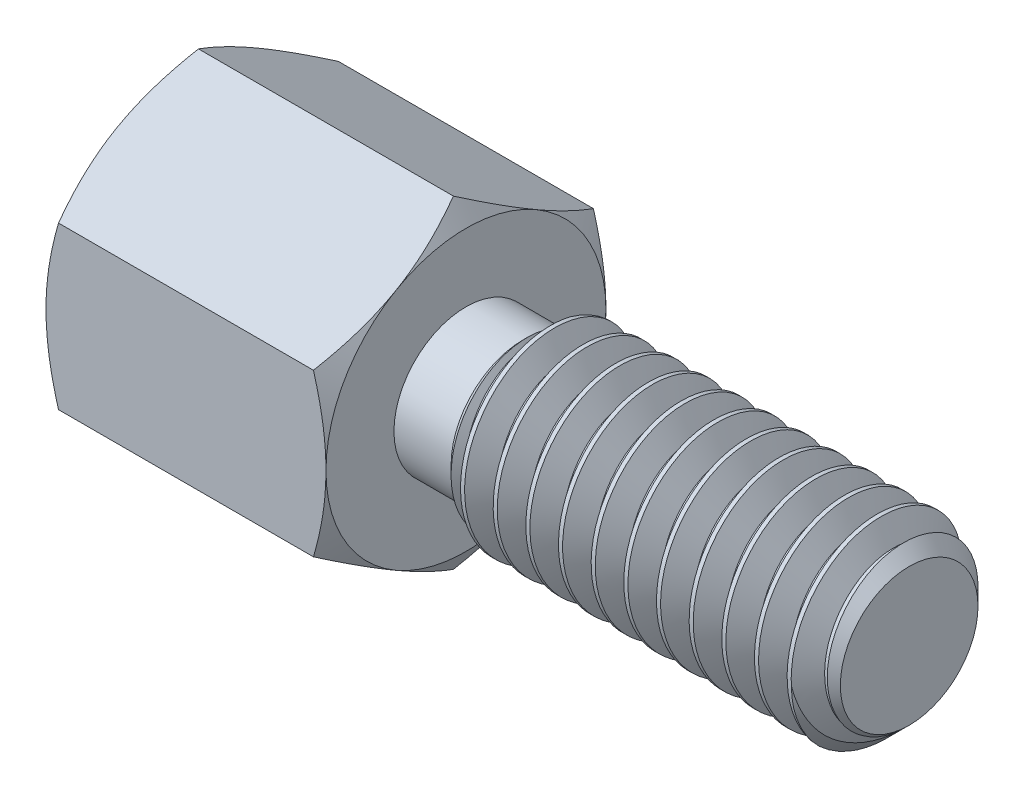
from build123d import *

# Parameters (mm, degrees)
SKETCH2_R         = 2
EXTRUDE1_DEPTH    = 9.5
CHAMFER1_SIZE     = 0.525
CUT_SWEEP1_PITCH  = 0.7
EXTRUDE4_DEPTH    = 6
SKETCH8_OUTSIDE_W = 71.056
SKETCH8_OUTSIDE_H = 71.984
SKETCH8_OUTSIDE_R = 3
EXTRUDE5_DEPTH    = 17.163229971
EXTRUDE5_DRAFT    = -60
SKETCH9_OUTSIDE_W = 51.604
SKETCH9_OUTSIDE_H = 52.532
SKETCH9_OUTSIDE_R = 3
EXTRUDE6_DEPTH    = 11.547511645
EXTRUDE6_DRAFT    = -60
EXTRUDE7_START    = -2.1
SKETCH10_R        = 2
EXTRUDE7_DEPTH    = 2.1
SWEEP3_PITCH      = 0.7
SKETCH13_R        = 2.0508
EXTRUDE8_DEPTH    = 17.16322999


with BuildPart() as part:
    # Sketch2 → Extrude1 (new body)
    with BuildSketch(Plane(origin=(7.75, 0, 0), x_dir=(0, 0, -1), z_dir=(1, 0, 0))):
        Circle(SKETCH2_R)
    extrude(amount=-EXTRUDE1_DEPTH)

    # Chamfer1
    chamfer1_edges = [part.edges().sort_by_distance(p)[0] for p in [
        (7.75, 0, 2),
    ]]
    chamfer(chamfer1_edges, length=CHAMFER1_SIZE)

    # Cut-Sweep1: the profile of Sketch4 profile screwed along a right-hand helix of 14.571429 turns, 6 arcs to a turn; built about Z, then put on its axis
    cut_sweep1_z = Axis((0, 0, 0), (0, 0, 1))
    cut_sweep1_corners = [(2.0003, 0, 0.000173205), (2.0003, 0, -0.612673205), (1.545336663, 0, -0.35), (1.545336663, 0, -0.2625)]
    with BuildLine(mode=Mode.PRIVATE) as cut_sweep1_profile:
        Line(cut_sweep1_corners[0], cut_sweep1_corners[1])
        Line(cut_sweep1_corners[1], cut_sweep1_corners[2])
        Line(cut_sweep1_corners[2], cut_sweep1_corners[3])
        Line(cut_sweep1_corners[3], cut_sweep1_corners[0])
    cut_sweep1_cap = Face(cut_sweep1_profile.wire())
    cut_sweep1_turn_angles = [0, 30, 60, 90, 120, 150, 180, 210, 240, 270, 300, 330, 360]
    cut_sweep1_turn_weights = [1, 0.8660254037844387, 1, 0.8660254037844387, 1, 0.8660254037844387, 1, 0.8660254037844387, 1, 0.8660254037844387, 1, 0.8660254037844387, 1]
    cut_sweep1_turn_rails = [Edge.make_bspline([Vector(p[0], p[1], 0).rotate(cut_sweep1_z, cut_sweep1_turn_angles[k]) / cut_sweep1_turn_weights[k] + Vector(0, 0, p[2] + CUT_SWEEP1_PITCH * cut_sweep1_turn_angles[k] / 360) for k in range(13)], [0, 0, 0, 1, 1, 2, 2, 3, 3, 4, 4, 5, 5, 6, 6, 6], 2, cut_sweep1_turn_weights) for p in cut_sweep1_corners]
    cut_sweep1_turn_sides = [Face.make_surface_from_curves(cut_sweep1_turn_rails[p[0]], cut_sweep1_turn_rails[p[1]]) for p in [(0, 1), (1, 2), (2, 3), (3, 0)]]
    cut_sweep1_last_angles = [5040, 5070, 5100, 5130, 5160, 5190, 5220, 5232.857142857, 5245.714285714]
    cut_sweep1_last_weights = [1, 0.8660254037844387, 1, 0.8660254037844387, 1, 0.8660254037844387, 1, 0.9749279121818085, 1]
    cut_sweep1_last_rails = [Edge.make_bspline([Vector(p[0], p[1], 0).rotate(cut_sweep1_z, cut_sweep1_last_angles[k]) / cut_sweep1_last_weights[k] + Vector(0, 0, p[2] + CUT_SWEEP1_PITCH * cut_sweep1_last_angles[k] / 360) for k in range(9)], [0, 0, 0, 1, 1, 2, 2, 3, 3, 4, 4, 4], 2, cut_sweep1_last_weights) for p in cut_sweep1_corners]
    cut_sweep1_last_sides = [Face.make_surface_from_curves(cut_sweep1_last_rails[p[0]], cut_sweep1_last_rails[p[1]]) for p in [(0, 1), (1, 2), (2, 3), (3, 0)]]
    cut_sweep1 = Plane(origin=(7.75, 0, 0), x_dir=(0, 1, 0), z_dir=(-1, 0, 0)) * Solid(Shell([*[p.moved(Location((0, 0, CUT_SWEEP1_PITCH * i))) for i in range(14) for p in cut_sweep1_turn_sides], *cut_sweep1_last_sides, cut_sweep1_cap, cut_sweep1_cap.rotate(cut_sweep1_z, 5245.714285714).moved(Location((0, 0, CUT_SWEEP1_PITCH * 5245.714285714 / 360)))]))
    add(cut_sweep1, mode=Mode.SUBTRACT)

    # Sketch16 → Cut-Revolve1 (revolve, cut)
    with BuildSketch(Plane.XY, mode=Mode.PRIVATE) as cut_revolve1_sk:
        Polygon((-1.75, 1.542796663), (-0.525, 1.542796663), (-0.067796663, 2), (-1.75, 2), align=None)
    revolve(cut_revolve1_sk.sketch.rotate(Axis((0, 0, 0), (1, 0, 0)), 290.071955741), axis=Axis((0, 0, 0), (1, 0, 0)), mode=Mode.SUBTRACT)

    # Sketch7 → Extrude4 (add)
    with BuildSketch(Plane(origin=(-1.75, 0, 0), x_dir=(0, 0, -1), z_dir=(1, 0, 0))):
        Polygon((0, 3.464101615), (-3, 1.732050808), (-3, -1.732050808), (0, -3.464101615), (3, -1.732050808), (3, 1.732050808), align=None)
    extrude(amount=-EXTRUDE4_DEPTH)


with BuildPart() as extrude5_tool:
    # Sketch8 outside → Extrude5 (with draft: the straight prism first)
    with BuildSketch(Plane.ZY.offset(7.75)):
        Rectangle(SKETCH8_OUTSIDE_W, SKETCH8_OUTSIDE_H)
        Circle(SKETCH8_OUTSIDE_R, mode=Mode.SUBTRACT)
    extrude(amount=-EXTRUDE5_DEPTH)
    # Extrude5: the draft: its side faces are tilted about the plane it starts from
    extrude5_sides = [extrude5_tool.faces().sort_by_distance(p)[0] for p in [
        (0.831614986, -35.992, 0),
        (0.831614986, 0, 35.528),
        (0.831614986, 35.992, 0),
        (0.831614986, 0, -35.528),
        (0.831614986, 0, -3),
    ]]
    draft(extrude5_sides, Plane.ZY.offset(7.75), EXTRUDE5_DRAFT)


with BuildPart() as part_1:
    add(part.part)

    # Extrude5: cut by extrude5_tool
    add(extrude5_tool.part, mode=Mode.SUBTRACT)


with BuildPart() as extrude6_tool:
    # Sketch9 outside → Extrude6 (with draft: the straight prism first)
    with BuildSketch(Plane(origin=(-1.75, 0, 0), x_dir=(0, 0, -1), z_dir=(1, 0, 0))):
        Rectangle(SKETCH9_OUTSIDE_W, SKETCH9_OUTSIDE_H)
        Circle(SKETCH9_OUTSIDE_R, mode=Mode.SUBTRACT)
    extrude(amount=-EXTRUDE6_DEPTH)
    # Extrude6: the draft: its side faces are tilted about the plane it starts from
    extrude6_sides = [extrude6_tool.faces().sort_by_distance(p)[0] for p in [
        (-7.523755822, -26.266, 0),
        (-7.523755822, 0, -25.802),
        (-7.523755822, 26.266, 0),
        (-7.523755822, 0, 25.802),
        (-7.523755822, 0, 3),
    ]]
    draft(extrude6_sides, Plane(origin=(-1.75, 0, 0), x_dir=(0, 0, -1), z_dir=(1, 0, 0)), EXTRUDE6_DRAFT)


with BuildPart() as part_2:
    add(part_1.part)

    # Extrude6: cut by extrude6_tool
    add(extrude6_tool.part, mode=Mode.SUBTRACT)

    # Sketch10 → Extrude7 (cut)
    with BuildSketch(Plane.ZY.offset(7.75).offset(EXTRUDE7_START)):
        Circle(SKETCH10_R)
    extrude(amount=EXTRUDE7_DEPTH, mode=Mode.SUBTRACT)

    # Sweep3: the profile of Sketch12 profile screwed along a right-hand helix of 3 turns, 6 arcs to a turn; built about Z, then put on its axis
    sweep3_z = Axis((0, 0, 0), (0, 0, 1))
    sweep3_corners = [(2.0003, 0, -0.612673205), (1.545336663, 0, -0.35), (1.545336663, 0, -0.2625), (2.0003, 0, 0.000173205)]
    with BuildLine(mode=Mode.PRIVATE) as sweep3_profile:
        Line(sweep3_corners[0], sweep3_corners[1])
        Line(sweep3_corners[1], sweep3_corners[2])
        Line(sweep3_corners[2], sweep3_corners[3])
        Line(sweep3_corners[3], sweep3_corners[0])
    sweep3_cap = Face(sweep3_profile.wire())
    sweep3_turn_angles = [0, 30, 60, 90, 120, 150, 180, 210, 240, 270, 300, 330, 360]
    sweep3_turn_weights = [1, 0.8660254037844387, 1, 0.8660254037844387, 1, 0.8660254037844387, 1, 0.8660254037844387, 1, 0.8660254037844387, 1, 0.8660254037844387, 1]
    sweep3_turn_rails = [Edge.make_bspline([Vector(p[0], p[1], 0).rotate(sweep3_z, sweep3_turn_angles[k]) / sweep3_turn_weights[k] + Vector(0, 0, p[2] + SWEEP3_PITCH * sweep3_turn_angles[k] / 360) for k in range(13)], [0, 0, 0, 1, 1, 2, 2, 3, 3, 4, 4, 5, 5, 6, 6, 6], 2, sweep3_turn_weights) for p in sweep3_corners]
    sweep3_turn_sides = [Face.make_surface_from_curves(sweep3_turn_rails[p[0]], sweep3_turn_rails[p[1]]) for p in [(0, 1), (1, 2), (2, 3), (3, 0)]]
    sweep3 = Plane(origin=(-7.75, 0, 0), x_dir=(0, 1, 0), z_dir=(1, 0, 0)) * Solid(Shell([*[p.moved(Location((0, 0, SWEEP3_PITCH * i))) for i in range(3) for p in sweep3_turn_sides], sweep3_cap, sweep3_cap.rotate(sweep3_z, 1080).moved(Location((0, 0, SWEEP3_PITCH * 1080 / 360)))]))
    add(sweep3)

    # Sketch13 → Extrude8 (cut)
    with BuildSketch(Plane.ZY.offset(7.75)):
        Circle(SKETCH13_R)
    extrude(amount=EXTRUDE8_DEPTH, mode=Mode.SUBTRACT)

    # Extrude8 cone 1 section (through the dimple's axis) → Extrude8 other way (revolve, cut)
    with BuildSketch(Plane(origin=(-7.75, 0, 0), x_dir=(0, 0, 1), z_dir=(0, 1, 0))):
        Polygon((0, 0), (2.0508, 0), (0, 2.0508), align=None)
    revolve(axis=Axis((-7.75, 0, 0), (1, 0, 0)), mode=Mode.SUBTRACT)


solid = part_2.part
